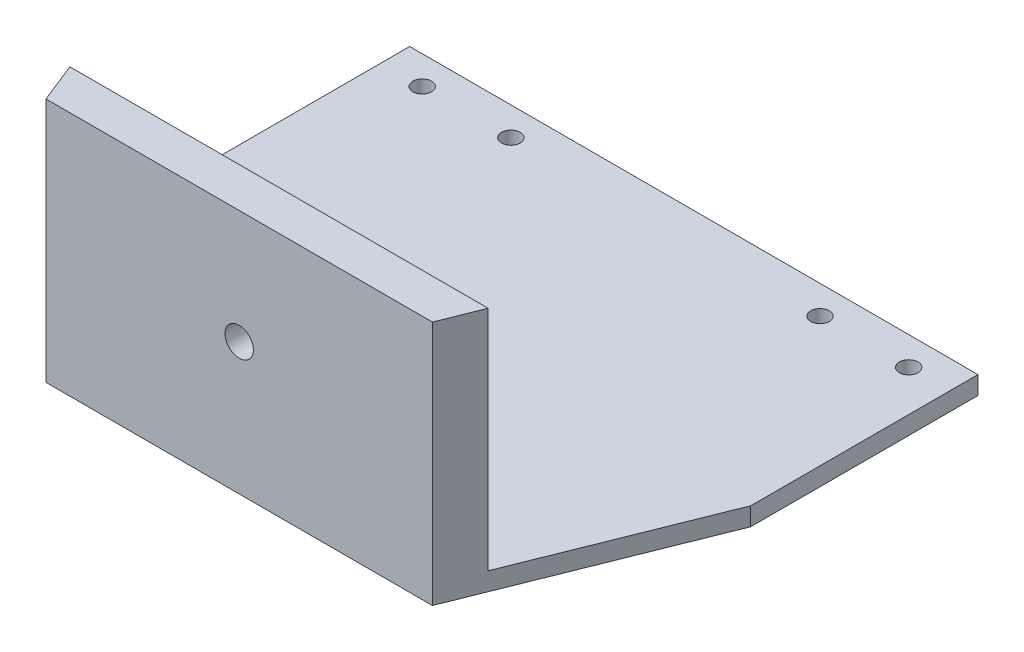
from build123d import *

# Parameters (mm, degrees)
SKETCH1_R           = 2.0828
BOSS_EXTRUDE1_DEPTH = 2.032
BOSS_EXTRUDE2_DEPTH = 50.8
SKETCH3_R           = 3.175
CUT_EXTRUDE1_DEPTH  = 125.171713059


with BuildPart() as part:
    # Sketch1 → Boss-Extrude1 (new, symmetric)
    with BuildSketch(Plane(origin=(0, 0, 0), x_dir=(1, 0, 0), z_dir=(0, 1, 0))):
        Polygon((43.18, -76.2), (63.5, -25.4), (63.5, 25.4), (-63.5, 25.4), (-63.5, -25.4), (-43.18, -76.2), align=None)
        with Locations((54.356, 19.05)):
            Circle(SKETCH1_R, mode=Mode.SUBTRACT)
        with Locations((-54.356, 19.05)):
            Circle(SKETCH1_R, mode=Mode.SUBTRACT)
        with Locations((-34.544, 19.05)):
            Circle(SKETCH1_R, mode=Mode.SUBTRACT)
        with Locations((34.544, 19.05)):
            Circle(SKETCH1_R, mode=Mode.SUBTRACT)
    extrude(amount=BOSS_EXTRUDE1_DEPTH, both=True)

    # Sketch2 → Boss-Extrude2 (add)
    with BuildSketch(Plane(origin=(0, 2.032, 0), x_dir=(1, 0, 0), z_dir=(0, 1, 0))):
        Polygon((-46.736, -67.31), (-43.18, -76.2), (43.18, -76.2), (46.736, -67.31), align=None)
    extrude(amount=BOSS_EXTRUDE2_DEPTH)

    # Sketch3 → Cut-Extrude1 (cut, through all)
    with BuildSketch(Plane(origin=(0, 0, 67.31), x_dir=(-1, 0, 0), z_dir=(0, 0, -1))):
        with Locations((0, 27.432)):
            Circle(SKETCH3_R)
    extrude(amount=-CUT_EXTRUDE1_DEPTH, mode=Mode.SUBTRACT)


solid = part.part
